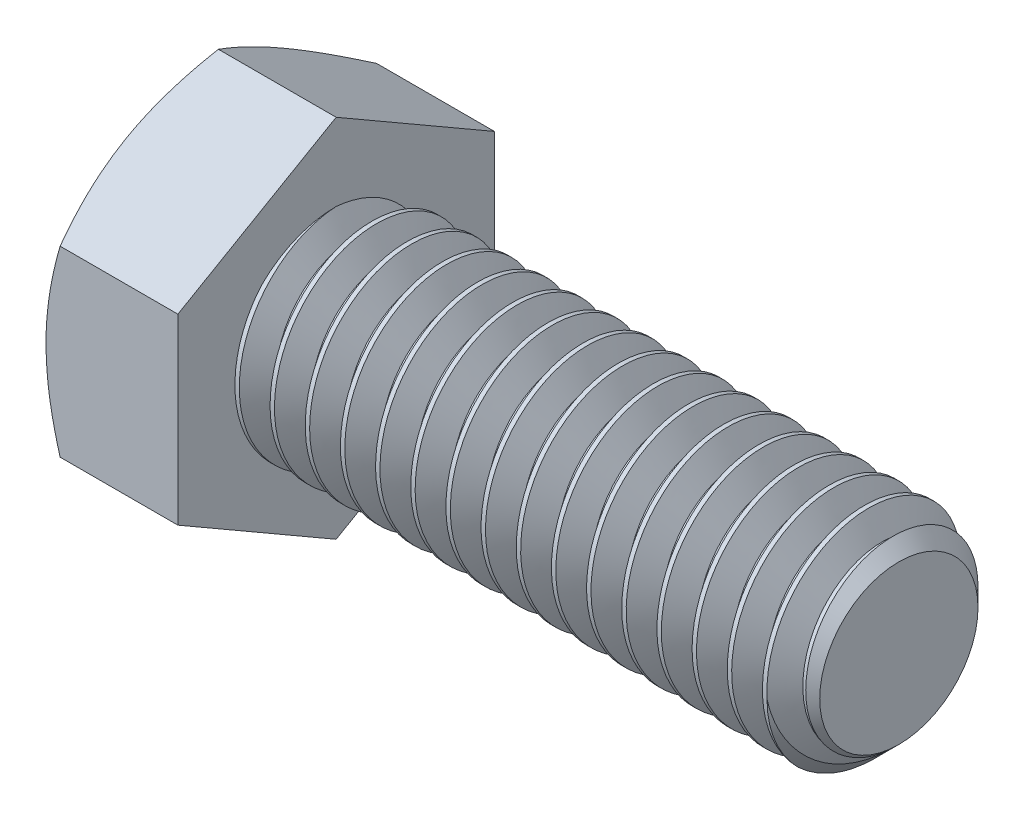
from build123d import *

# Parameters (mm, degrees)
SKETCH5_R           = 4.7625
BOSS_EXTRUDE3_DEPTH = 25.4
CHAMFER1_SIZE       = 1.190625
CUT_SWEEP1_PITCH    = 1.5875
BOSS_EXTRUDE4_DEPTH = 5.953125
SKETCH8_OUTSIDE_W   = 142.392
SKETCH8_OUTSIDE_H   = 144.602
SKETCH8_OUTSIDE_R   = 7.14375
CUT_EXTRUDE3_DEPTH  = 34.197828836
CUT_EXTRUDE3_DRAFT  = -60


with BuildPart() as part:
    # Sketch5 → Boss-Extrude3 (new body)
    with BuildSketch(Plane(origin=(15.6765625, 0, 0), x_dir=(0, 0, -1), z_dir=(1, 0, 0))):
        Circle(SKETCH5_R)
    extrude(amount=-BOSS_EXTRUDE3_DEPTH)

    # Chamfer1
    chamfer1_edges = [part.edges().sort_by_distance(p)[0] for p in [
        (15.6765625, 0, 4.7625),
    ]]
    chamfer(chamfer1_edges, length=CHAMFER1_SIZE)

    # Cut-Sweep1: the profile of Sketch10 profile screwed along a right-hand helix of 17 turns, 8 arcs to a turn; built about Z, then put on its axis
    cut_sweep1_z = Axis((0, 0, 0), (0, 0, 1))
    cut_sweep1_corners = [(4.7628, 0, 0.000173205), (3.731388504, 0, -0.5953125), (3.731388504, 0, -0.79375), (4.7628, 0, -1.389235705)]
    with BuildLine(mode=Mode.PRIVATE) as cut_sweep1_profile:
        Line(cut_sweep1_corners[0], cut_sweep1_corners[1])
        Line(cut_sweep1_corners[1], cut_sweep1_corners[2])
        Line(cut_sweep1_corners[2], cut_sweep1_corners[3])
        Line(cut_sweep1_corners[3], cut_sweep1_corners[0])
    cut_sweep1_cap = Face(cut_sweep1_profile.wire())
    cut_sweep1_turn_angles = [0, 22.5, 45, 67.5, 90, 112.5, 135, 157.5, 180, 202.5, 225, 247.5, 270, 292.5, 315, 337.5, 360]
    cut_sweep1_turn_weights = [1, 0.9238795325112867, 1, 0.9238795325112867, 1, 0.9238795325112867, 1, 0.9238795325112867, 1, 0.9238795325112867, 1, 0.9238795325112867, 1, 0.9238795325112867, 1, 0.9238795325112867, 1]
    cut_sweep1_turn_rails = [Edge.make_bspline([Vector(p[0], p[1], 0).rotate(cut_sweep1_z, cut_sweep1_turn_angles[k]) / cut_sweep1_turn_weights[k] + Vector(0, 0, p[2] + CUT_SWEEP1_PITCH * cut_sweep1_turn_angles[k] / 360) for k in range(17)], [0, 0, 0, 1, 1, 2, 2, 3, 3, 4, 4, 5, 5, 6, 6, 7, 7, 8, 8, 8], 2, cut_sweep1_turn_weights) for p in cut_sweep1_corners]
    cut_sweep1_turn_sides = [Face.make_surface_from_curves(cut_sweep1_turn_rails[p[0]], cut_sweep1_turn_rails[p[1]]) for p in [(0, 1), (1, 2), (2, 3), (3, 0)]]
    cut_sweep1 = Plane(origin=(15.6765625, 0, 0), x_dir=(0, 1, 0), z_dir=(-1, 0, 0)) * Solid(Shell([*[p.moved(Location((0, 0, CUT_SWEEP1_PITCH * i))) for i in range(17) for p in cut_sweep1_turn_sides], cut_sweep1_cap, cut_sweep1_cap.rotate(cut_sweep1_z, 6120).moved(Location((0, 0, CUT_SWEEP1_PITCH * 6120 / 360)))]))
    add(cut_sweep1, mode=Mode.SUBTRACT)

    # Sketch6 → Boss-Extrude4 (add)
    with BuildSketch(Plane.ZY.offset(9.7234375)):
        Polygon((7.14375, 4.124445986), (0, 8.248891971), (-7.14375, 4.124445986), (-7.14375, -4.124445986), (0, -8.248891971), (7.14375, -4.124445986), align=None)
    extrude(amount=BOSS_EXTRUDE4_DEPTH)


with BuildPart() as cut_extrude3_tool:
    # Sketch8 outside → Cut-Extrude3 (with draft: the straight prism first)
    with BuildSketch(Plane.ZY.offset(15.6765625)):
        Rectangle(SKETCH8_OUTSIDE_W, SKETCH8_OUTSIDE_H)
        Circle(SKETCH8_OUTSIDE_R, mode=Mode.SUBTRACT)
    extrude(amount=-CUT_EXTRUDE3_DEPTH)
    # Cut-Extrude3: the draft: its side faces are tilted about the plane it starts from
    cut_extrude3_sides = [cut_extrude3_tool.faces().sort_by_distance(p)[0] for p in [
        (1.422351918, -72.301, 0),
        (1.422351918, 0, 71.196),
        (1.422351918, 72.301, 0),
        (1.422351918, 0, -71.196),
        (1.422351918, 0, -7.14375),
    ]]
    draft(cut_extrude3_sides, Plane.ZY.offset(15.6765625), CUT_EXTRUDE3_DRAFT)


with BuildPart() as part_1:
    add(part.part)

    # Cut-Extrude3: cut by cut_extrude3_tool
    add(cut_extrude3_tool.part, mode=Mode.SUBTRACT)


solid = part_1.part
